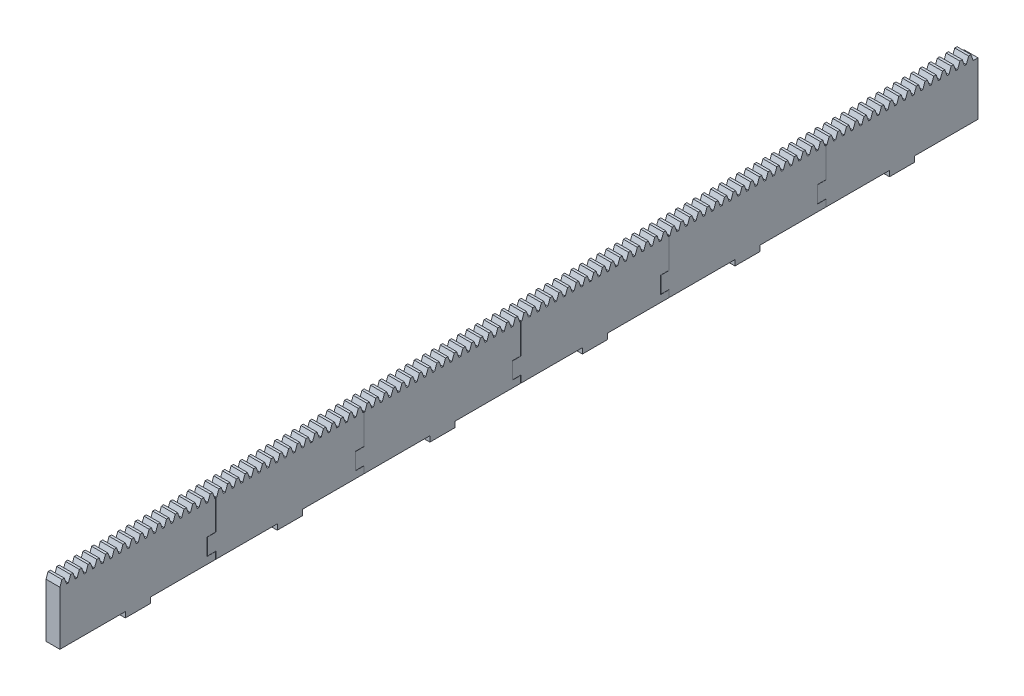
from build123d import *

# Parameters (mm, degrees)
SKETCH_2_W                  = 662
SKETCH_2_H                  = 38.37525226
EXTRUDE_1_DEPTH             = 10
EXTRUDE_2_DEPTH             = 10
PATTERN_LINEAR_1_COUNT      = 105
PATTERN_LINEAR_1_PITCH      = 6.283185307
SKETCH_8421_W               = 20
SKETCH_8421_H               = 8
EXTRUDE_8431_DEPTH          = 22
SKETCH_8606_W               = 18
SKETCH_8606_H               = 4.01
EXTRUDE_4_DEPTH             = 10
CUT_EXTRUDE_5_DEPTH         = 90940.510009329
CUT_EXTRUDE_5_DEPTH_BACK    = 90940.510009329
SKETCH_8816_R               = 2.75
CUT_EXTRUDE_5_4_3_DEPTH     = 4.3
CUT_EXTRUDE_6_DEPTH         = 90940.510009329
CUT_EXTRUDE_6_DEPTH_BACK    = 90940.510009329
CUT_EXTRUDE_0_15_DEPTH      = 90940.510009329
CUT_EXTRUDE_0_15_DEPTH_BACK = 90940.510009329
SKETCH_9510_W               = 11.96043534
SKETCH_9510_H               = 56
SKETCH_9510_W_2             = 10.15


with BuildPart() as part:
    # Эскиз2 → Бобышка-Вытянуть1 (new body)
    with BuildSketch(Plane(origin=(0, 0, 0), x_dir=(0, 0, -1), z_dir=(1, 0, 0))):
        with Locations((304.45000531, -90914.099555903)):
            Rectangle(SKETCH_2_W, SKETCH_2_H)
    extrude(amount=EXTRUDE_1_DEPTH)

    # Эскиз3 → Бобышка-Вытянуть2 (add)
    with BuildSketch(Plane(origin=(10, 0, 0), x_dir=(0, 0, -1), z_dir=(1, 0, 0))):
        Polygon((-26.54999469, -90894.911929773), (-24.91249469, -90890.411929773), (-23.22649469, -90890.411929773), (-21.58899469, -90894.911929773), align=None)
    extrude_2 = extrude(amount=-EXTRUDE_2_DEPTH)

    # Линейный массив1: Бобышка-Вытянуть2 ×105
    with Locations(*[(0, 0, -i * PATTERN_LINEAR_1_PITCH) for i in range(1, PATTERN_LINEAR_1_COUNT)]):
        add(extrude_2)

    # Sketch 8421 → Extrude 8431 (add)
    with BuildSketch(Plane(origin=(0, 0, 0), x_dir=(0, 0, -1), z_dir=(1, 0, 0))):
        with Locations((580.504612499, -90929.287182033)):
            Rectangle(SKETCH_8421_W, SKETCH_8421_H)
        with Locations((469.160551924, -90929.287182033)):
            Rectangle(SKETCH_8421_W, SKETCH_8421_H)
        with Locations((359.204809048, -90929.287182033)):
            Rectangle(SKETCH_8421_W, SKETCH_8421_H)
        with Locations((249.249066172, -90929.287182033)):
            Rectangle(SKETCH_8421_W, SKETCH_8421_H)
        with Locations((139.293323297, -90929.287182033)):
            Rectangle(SKETCH_8421_W, SKETCH_8421_H)
        with Locations((29.743126748, -90929.287182033)):
            Rectangle(SKETCH_8421_W, SKETCH_8421_H)
    extrude(amount=-EXTRUDE_8431_DEPTH)

    # Sketch 8606 → Шипы_рейки_4мм (add)
    with BuildSketch(Plane(origin=(0, 0, 0), x_dir=(0, 0, -1), z_dir=(1, 0, 0))):
        with Locations((580.504612499, -90935.282182033)):
            Rectangle(SKETCH_8606_W, SKETCH_8606_H)
        with Locations((469.160551924, -90935.282182033)):
            Rectangle(SKETCH_8606_W, SKETCH_8606_H)
        with Locations((359.204809048, -90935.282182033)):
            Rectangle(SKETCH_8606_W, SKETCH_8606_H)
        with Locations((249.249066172, -90935.282182033)):
            Rectangle(SKETCH_8606_W, SKETCH_8606_H)
        with Locations((139.293323297, -90935.282182033)):
            Rectangle(SKETCH_8606_W, SKETCH_8606_H)
        with Locations((29.743126748, -90935.282182033)):
            Rectangle(SKETCH_8606_W, SKETCH_8606_H)
    extrude(amount=EXTRUDE_4_DEPTH)

    # Sketch 8816 → Болты_рейки_М5 (cut, two sides: drawn at the far end of the back side and taken through both)
    with BuildSketch(Plane(origin=(0, 0, 0), x_dir=(1, 0, 0), z_dir=(0, 1, 0)).offset(-CUT_EXTRUDE_5_DEPTH_BACK)):
        with Locations((-11, 580.504612499)):
            Circle(SKETCH_8816_R)
        with Locations((-11, 469.160551924)):
            Circle(SKETCH_8816_R)
        with Locations((-11, 359.204809048)):
            Circle(SKETCH_8816_R)
        with Locations((-11, 249.249066172)):
            Circle(SKETCH_8816_R)
        with Locations((-11, 139.293323297)):
            Circle(SKETCH_8816_R)
        with Locations((-11, 29.743126748)):
            Circle(SKETCH_8816_R)
    extrude(amount=CUT_EXTRUDE_5_DEPTH + CUT_EXTRUDE_5_DEPTH_BACK, mode=Mode.SUBTRACT)

    # Sketch 8866 → Гайки_рейки_М5_4_3мм (cut)
    with BuildSketch(Plane(origin=(0, -90925.287182033, 0), x_dir=(1, 0, 0), z_dir=(0, 1, 0))):
        Polygon((-6.207992766, 580.504612499), (-8.603996383, 576.354612499), (-13.396003617, 576.354612499), (-15.792007234, 580.504612499), (-13.396003617, 584.654612499), (-8.603996383, 584.654612499), align=None)
        Polygon((-6.207992766, 469.160551924), (-8.603996383, 465.010551924), (-13.396003617, 465.010551924), (-15.792007234, 469.160551924), (-13.396003617, 473.310551924), (-8.603996383, 473.310551924), align=None)
        Polygon((-6.207992766, 359.204809048), (-8.603996383, 355.054809048), (-13.396003617, 355.054809048), (-15.792007234, 359.204809048), (-13.396003617, 363.354809048), (-8.603996383, 363.354809048), align=None)
        Polygon((-6.207992766, 249.249066172), (-8.603996383, 245.099066172), (-13.396003617, 245.099066172), (-15.792007234, 249.249066172), (-13.396003617, 253.399066172), (-8.603996383, 253.399066172), align=None)
        Polygon((-6.207992766, 139.293323297), (-8.603996383, 135.143323297), (-13.396003617, 135.143323297), (-15.792007234, 139.293323297), (-13.396003617, 143.443323297), (-8.603996383, 143.443323297), align=None)
        Polygon((-6.207992766, 29.743126748), (-8.603996383, 25.593126748), (-13.396003617, 25.593126748), (-15.792007234, 29.743126748), (-13.396003617, 33.893126748), (-8.603996383, 33.893126748), align=None)
    extrude(amount=-CUT_EXTRUDE_5_4_3_DEPTH, mode=Mode.SUBTRACT)

    # Sketch 8999 → Секции_рейки_шип_паз_6шт (cut, two sides: drawn at the far end of the back side and taken through both)
    with BuildSketch(Plane(origin=(0, 0, 0), x_dir=(0, 0, -1), z_dir=(1, 0, 0)).offset(-CUT_EXTRUDE_6_DEPTH_BACK)):
        Polygon((525.784219688, -90938.287182033), (525.634219688, -90938.287182033), (525.634219688, -90928.362182033), (519.634219688, -90928.362182033), (519.634219688, -90916.212182033), (525.634219688, -90916.212182033), (525.634219688, -90888.287182033), (525.784219688, -90888.287182033), (525.784219688, -90916.362182033), (519.784219688, -90916.362182033), (519.784219688, -90928.212182033), (525.784219688, -90928.212182033), align=None)
        Polygon((412.686884159, -90938.287182033), (412.536884159, -90938.287182033), (412.536884159, -90928.362182033), (406.536884159, -90928.362182033), (406.536884159, -90916.212182033), (412.536884159, -90916.212182033), (412.536884159, -90888.287182033), (412.686884159, -90888.287182033), (412.686884159, -90916.362182033), (406.686884159, -90916.362182033), (406.686884159, -90928.212182033), (412.686884159, -90928.212182033), align=None)
        Polygon((305.872733937, -90938.287182033), (305.722733937, -90938.287182033), (305.722733937, -90928.362182033), (299.722733937, -90928.362182033), (299.722733937, -90916.212182033), (305.722733937, -90916.212182033), (305.722733937, -90888.287182033), (305.872733937, -90888.287182033), (305.872733937, -90916.362182033), (299.872733937, -90916.362182033), (299.872733937, -90928.212182033), (305.872733937, -90928.212182033), align=None)
        Polygon((192.775398408, -90938.287182033), (192.625398408, -90938.287182033), (192.625398408, -90928.362182033), (186.625398408, -90928.362182033), (186.625398408, -90916.212182033), (192.625398408, -90916.212182033), (192.625398408, -90888.287182033), (192.775398408, -90888.287182033), (192.775398408, -90916.362182033), (186.775398408, -90916.362182033), (186.775398408, -90928.212182033), (192.775398408, -90928.212182033), align=None)
        Polygon((85.961248186, -90938.287182033), (85.811248186, -90938.287182033), (85.811248186, -90928.362182033), (79.811248186, -90928.362182033), (79.811248186, -90916.212182033), (85.811248186, -90916.212182033), (85.811248186, -90888.287182033), (85.961248186, -90888.287182033), (85.961248186, -90916.362182033), (79.961248186, -90916.362182033), (79.961248186, -90928.212182033), (85.961248186, -90928.212182033), align=None)
    extrude(amount=CUT_EXTRUDE_6_DEPTH + CUT_EXTRUDE_6_DEPTH_BACK, mode=Mode.SUBTRACT)


with BuildPart() as cut_extrude_6_piece_1:
    # of the separate pieces the step leaves, piece 1, a body of its own (cut_extrude_6_pieces)
    add(part.part.solids().sort_by_distance((0, -90933.287182033, -412.686884159))[0])


with BuildPart() as cut_extrude_6_piece_2:
    # of the separate pieces the step leaves, piece 2, a body of its own (cut_extrude_6_pieces)
    add(part.part.solids().sort_by_distance((0, -90933.287182033, -192.775398408))[0])


with BuildPart() as cut_extrude_6_piece_3:
    # of the separate pieces the step leaves, piece 3, a body of its own (cut_extrude_6_pieces)
    add(part.part.solids().sort_by_distance((0, -90933.287182033, -525.784219688))[0])


with BuildPart() as cut_extrude_6_piece_4:
    # of the separate pieces the step leaves, piece 4, a body of its own (cut_extrude_6_pieces)
    add(part.part.solids().sort_by_distance((0, -90933.287182033, 26.54999469))[0])


with BuildPart() as cut_extrude_6_piece_5:
    # of the separate pieces the step leaves, piece 5, a body of its own (cut_extrude_6_pieces)
    add(part.part.solids().sort_by_distance((0, -90933.287182033, -85.961248186))[0])


with BuildPart() as cut_extrude_6_piece_6:
    # of the separate pieces the step leaves, piece 6, a body of its own (cut_extrude_6_pieces)
    add(part.part.solids().sort_by_distance((0, -90933.287182033, -305.872733937))[0])


with BuildPart() as cut_extrude_0_15_tool:
    # Sketch 9510 → Торцы_рейки_зазор_0_15мм (new, two sides: drawn at the far end of the back side and taken through both)
    with BuildSketch(Plane(origin=(0, 0, 0), x_dir=(0, 0, -1), z_dir=(1, 0, 0)).offset(-CUT_EXTRUDE_0_15_DEPTH_BACK)):
        with Locations((641.28022298, -90911.287182033)):
            Rectangle(SKETCH_9510_W, SKETCH_9510_H)
        with Locations((-31.47499469, -90911.287182033)):
            Rectangle(SKETCH_9510_W_2, SKETCH_9510_H)
    extrude(amount=CUT_EXTRUDE_0_15_DEPTH + CUT_EXTRUDE_0_15_DEPTH_BACK)


with BuildPart() as cut_extrude_6_piece_3_1:
    add(cut_extrude_6_piece_3.part)

    # Торцы_рейки_зазор_0_15мм: cut by cut_extrude_0_15_tool
    add(cut_extrude_0_15_tool.part, mode=Mode.SUBTRACT)


with BuildPart() as cut_extrude_6_piece_4_1:
    add(cut_extrude_6_piece_4.part)

    # Торцы_рейки_зазор_0_15мм: cut by cut_extrude_0_15_tool
    add(cut_extrude_0_15_tool.part, mode=Mode.SUBTRACT)


solid = Compound([cut_extrude_6_piece_1.part, cut_extrude_6_piece_2.part, cut_extrude_6_piece_5.part, cut_extrude_6_piece_6.part, cut_extrude_6_piece_3_1.part, cut_extrude_6_piece_4_1.part])
